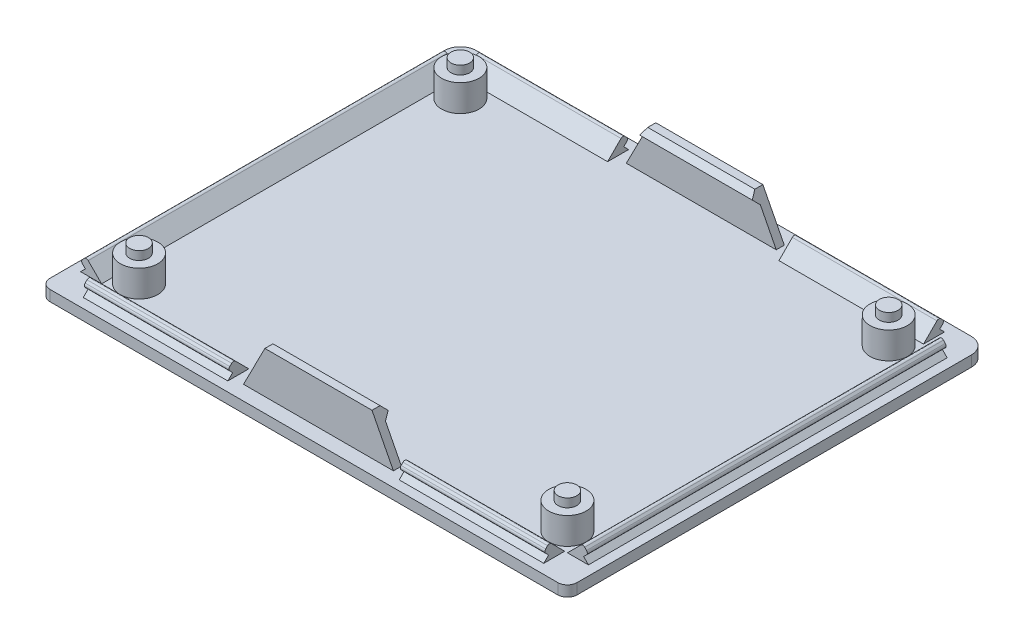
from build123d import *

# Parameters (mm, degrees)
SKETCH2_R            = 3.5
BOSS_EXTRUDE1_DEPTH  = 5
SKETCH3_R            = 1.75
BOSS_EXTRUDE2_DEPTH  = 1.6
SKETCH1_W            = 98.44
SKETCH1_H            = 78.44
BOSS_EXTRUDE4_DEPTH  = 2
BOSS_EXTRUDE5_START  = -63.5
BOSS_EXTRUDE5_DEPTH  = 67
FILLET1_R            = 0.5
FILLET1_OF_MIRROR1_R = 0.5
BOSS_EXTRUDE8_DEPTH  = 43
CUT_EXTRUDE4_DEPTH   = 16
BOSS_EXTRUDE9_DEPTH  = 14
CHAMFER3_START       = -66.5
CHAMFER3_DEPTH       = 2.5
CHAMFER4_SIZE2       = 4
CHAMFER4_SIZE        = 7.8
FILLET2_R            = 0.5
FILLET2_OF_MIRROR2_R = 0.5
FILLET3_R            = 3
CHAMFER5_SIZE2       = 4
CHAMFER5_SIZE        = 7.8
CHAMFER6_SIZE2       = 7.8
CHAMFER6_SIZE        = 4
FILLET4_R            = 1.8


with BuildPart() as part:
    # Sketch2 → Boss-Extrude1 (new body)
    with BuildSketch(Plane(origin=(0, 0, 0), x_dir=(1, 0, 0), z_dir=(0, 1, 0))):
        with Locations(Location((0, 0, 0), (0, 0, 270))):
            Circle(SKETCH2_R)
    boss_extrude1 = extrude(amount=BOSS_EXTRUDE1_DEPTH)

    # Sketch3 → Boss-Extrude2 (add)
    with BuildSketch(Plane(origin=(0, 5, 0), x_dir=(1, 0, 0), z_dir=(0, 1, 0))):
        with Locations(Location((0, 0, 0), (0, 0, 270))):
            Circle(SKETCH3_R)
    boss_extrude2 = extrude(amount=BOSS_EXTRUDE2_DEPTH)

    # Sketch1 → Boss-Extrude4 (add)
    with BuildSketch(Plane(origin=(0, 0, 0), x_dir=(1, 0, 0), z_dir=(0, 1, 0))):
        with Locations((40, 30)):
            Rectangle(SKETCH1_W, SKETCH1_H)
    extrude(amount=-BOSS_EXTRUDE4_DEPTH)

    # Sketch-Pattern2: Boss-Extrude1, Boss-Extrude2 at 3 more places
    with Locations((80, 0, 0), (80, 0, -60), (0, 0, -60)):
        add(boss_extrude1)
        add(boss_extrude2)

    # Sketch6 → Boss-Extrude5 (add)
    with BuildSketch(Plane.XY.offset(BOSS_EXTRUDE5_START)):
        Polygon((-7.421320344, 1.8), (-6.360660172, 2.860660172), (-3.5, 0), (-7.421320344, 0), (-6.521320344, 0.9), align=None)
    boss_extrude5 = extrude(amount=BOSS_EXTRUDE5_DEPTH)

    # Fillet1
    fillet1_edges = [part.edges().sort_by_distance(p)[0] for p in [
        (-7.421320344, 1.8, -30),
        (-6.360660172, 2.860660172, -30),
    ]]
    fillet(fillet1_edges, radius=FILLET1_R)

    # Mirror1: Boss-Extrude5 across plane
    add(boss_extrude5.mirror(Plane(origin=(40, 0, 0), x_dir=(0, 0, 1), z_dir=(1, 0, 0))))

    # Fillet1 of Mirror1
    fillet1_of_mirror1_edges = [part.edges().sort_by_distance(p)[0] for p in [
        (87.421320344, 1.8, -30),
        (86.360660172, 2.860660172, -30),
    ]]
    fillet(fillet1_of_mirror1_edges, radius=FILLET1_OF_MIRROR1_R)

    # Sketch8 → Boss-Extrude8 (add, symmetric)
    with BuildSketch(Plane(origin=(40, 0, 0), x_dir=(0, 0, -1), z_dir=(1, 0, 0))):
        Polygon((66.360660172, 2.860660172), (63.5, 0), (67.421320344, 0), (66.521320344, 0.9), (67.421320344, 1.8), align=None)
    boss_extrude8 = extrude(amount=BOSS_EXTRUDE8_DEPTH, both=True)

    # Sketch8<4> → Cut-Extrude4 (cut, symmetric)
    with BuildSketch(Plane(origin=(40, 0, 0), x_dir=(0, 0, -1), z_dir=(1, 0, 0))):
        Polygon((66.360660172, 2.860660172), (63.5, 0), (67.421320344, 0), (66.521320344, 0.9), (67.421320344, 1.8), align=None)
    cut_extrude4 = extrude(amount=CUT_EXTRUDE4_DEPTH, both=True, mode=Mode.SUBTRACT)

    # Sketch7 → Boss-Extrude9 (add, symmetric)
    with BuildSketch(Plane(origin=(40, 0, 0), x_dir=(0, 0, -1), z_dir=(1, 0, 0))):
        Polygon((66.5, 7.8), (66.5, 0), (65, 0), (65, 5.8), (64, 6.8), (65, 7.8), align=None)
    boss_extrude9 = extrude(amount=BOSS_EXTRUDE9_DEPTH, both=True)

    # Chamfer3: read off the stored shape, not the designer's step
    # Chamfer3 outline → Chamfer3 (cut)
    with BuildSketch(Plane.XY.offset(CHAMFER3_START)):
        Polygon((26, 7.8), (26, 0), (30, 7.8), align=None)
    extrude(amount=CHAMFER3_DEPTH, mode=Mode.SUBTRACT)

    # Chamfer4
    chamfer4_edges = [part.edges().sort_by_distance(p)[0] for p in [
        (54, 7.8, -65.75),
    ]]
    chamfer4_side = [part.faces().sort_by_distance(p)[0] for p in [
        (54, 7.72, -65.75),
    ]]
    chamfer(chamfer4_edges, length=CHAMFER4_SIZE - 0.0001, length2=CHAMFER4_SIZE2 - 0.0001, reference=chamfer4_side[0])  # a hair under: the kernel refuses the full size

    # Fillet2
    fillet2_edges = [part.edges().sort_by_distance(p)[0] for p in [
        (10.5, 2.860660172, -66.360660172),
        (10.5, 1.8, -67.421320344),
        (69.5, 2.860660172, -66.360660172),
        (69.5, 1.8, -67.421320344),
    ]]
    fillet(fillet2_edges, radius=FILLET2_R)

    # Mirror2: Boss-Extrude8, Cut-Extrude4 across plane
    add(boss_extrude8.mirror(Plane.XY.offset(-30)))
    add(cut_extrude4.mirror(Plane.XY.offset(-30)), mode=Mode.SUBTRACT)

    # Fillet2 of Mirror2
    fillet2_of_mirror2_edges = [part.edges().sort_by_distance(p)[0] for p in [
        (10.5, 2.860660172, 6.360660172),
        (10.5, 1.8, 7.421320344),
        (69.5, 2.860660172, 6.360660172),
        (69.5, 1.8, 7.421320344),
    ]]
    fillet(fillet2_of_mirror2_edges, radius=FILLET2_OF_MIRROR2_R)

    # Fillet3
    fillet3_edges = [part.edges().sort_by_distance(p)[0] for p in [
        (-9.22, -1, -69.22),
        (89.22, -1, -69.22),
    ]]
    fillet(fillet3_edges, radius=FILLET3_R)

    # Mirror4: Boss-Extrude9 across plane
    add(boss_extrude9.mirror(Plane.XY.offset(-30)))

    # Chamfer5
    chamfer5_edges = [part.edges().sort_by_distance(p)[0] for p in [
        (26, 7.8, 5.75),
    ]]
    chamfer5_side = [part.faces().sort_by_distance(p)[0] for p in [
        (26, 7.72, 5.75),
    ]]
    chamfer(chamfer5_edges, length=CHAMFER5_SIZE - 0.0001, length2=CHAMFER5_SIZE2 - 0.0001, reference=chamfer5_side[0])  # a hair under: the kernel refuses the full size

    # Chamfer6
    chamfer6_edges = [part.edges().sort_by_distance(p)[0] for p in [
        (54, 7.8, 5.75),
    ]]
    chamfer6_side = [part.faces().sort_by_distance(p)[0] for p in [
        (53.92, 7.8, 5.75),
    ]]
    chamfer(chamfer6_edges, length=CHAMFER6_SIZE - 0.0001, length2=CHAMFER6_SIZE2 - 0.0001, reference=chamfer6_side[0])  # a hair under: the kernel refuses the full size

    # Fillet4
    fillet4_edges = [part.edges().sort_by_distance(p)[0] for p in [
        (89.22, -1, 9.22),
        (-9.22, -1, 9.22),
    ]]
    fillet(fillet4_edges, radius=FILLET4_R)


solid = part.part
